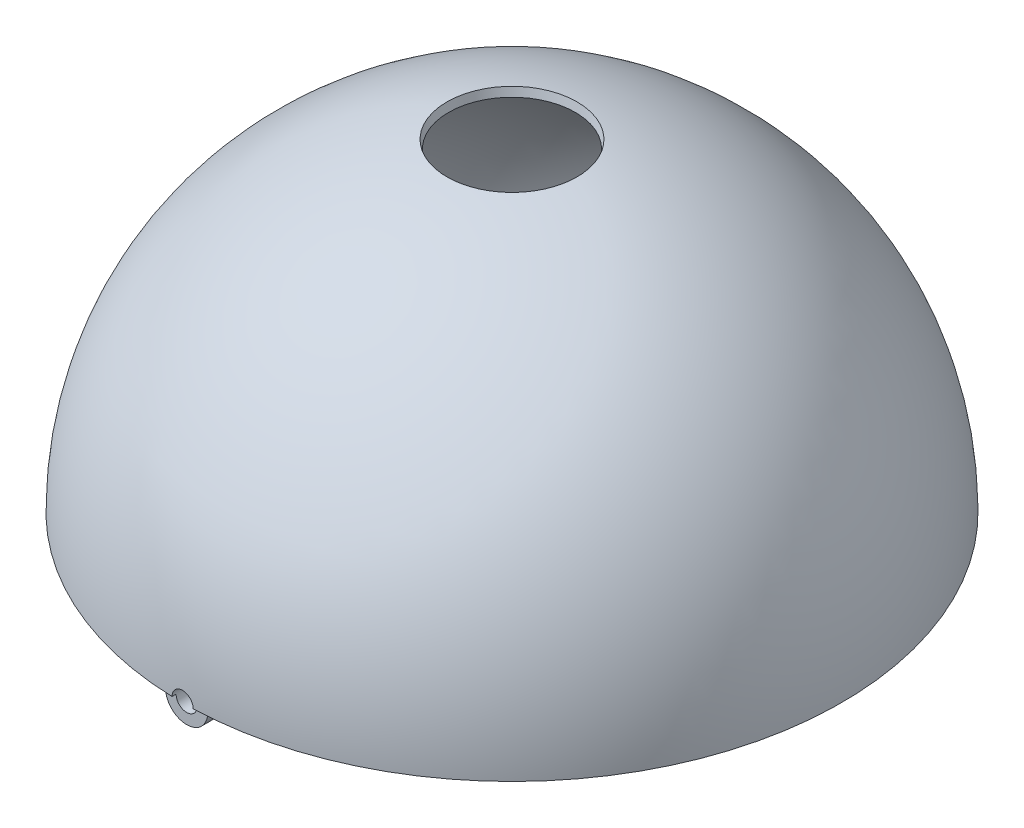
from build123d import *

# Parameters (mm, degrees)
SKETCH2_R           = 5
BOSS_EXTRUDE1_DEPTH = 10
CUT_EXTRUDE1_START  = -5
SKETCH4_R           = 1.4
CUT_EXTRUDE1_DEPTH  = 5
SKETCH5_R           = 2.45
CUT_EXTRUDE2_DEPTH  = 3
SKETCH6_R           = 2.5
CUT_EXTRUDE3_DEPTH  = 13
SKETCH7_R           = 1
CUT_EXTRUDE4_DEPTH  = 13


with BuildPart() as part:
    # Sketch1 → Revolve1 (revolve)
    with BuildSketch(Plane.XY):
        with BuildLine():
            Line((-78, 0), (-76, 0))
            ThreePointArc((-76, 0), (-58.804761712, 48.145612469), (-15, 74.505033387))
            Line((-15, 74.505033387), (-15.394736842, 76.46569216))
            ThreePointArc((-15.394736842, 76.46569216), (-60.352255441, 49.412602271), (-78, 0))
        make_face()
    revolve(axis=Axis((0, 0, 0), (0, 1, 0)))

    # Sketch2 → Boss-Extrude1 (add)
    with BuildSketch(Plane.XY.offset(77)):
        Circle(SKETCH2_R)
    boss_extrude1 = extrude(amount=-BOSS_EXTRUDE1_DEPTH)

    # Sketch3 → Revolve2 (revolve)
    with BuildSketch(Plane.XY):
        with BuildLine():
            Line((-30.7, 59.691121618), (-30.7, 69.691121618))
            ThreePointArc((-30.7, 69.691121618), (-39.521503729, 65.237677957), (-47.7, 59.691121618))
            Line((-47.7, 59.691121618), (-30.7, 59.691121618))
        make_face()
    revolve(axis=Axis((0, 76.46569216, 0), (0, -1, 0)))

    # Sketch4 → Cut-Extrude1 (cut)
    # profile 1 of 3: a face of its own
    with BuildSketch(Plane.XZ.offset(-59.691121618).offset(CUT_EXTRUDE1_START)):
        with Locations((-34.1, 3.2)):
            Circle(SKETCH4_R)
    # profile 2 of 3: a face of its own
    with BuildSketch(Plane.XZ.offset(-59.691121618).offset(CUT_EXTRUDE1_START)):
        with Locations((-34.1, -3.2)):
            Circle(SKETCH4_R)
    # profile 3 of 3: a face of its own
    with BuildSketch(Plane.XZ.offset(-59.691121618).offset(CUT_EXTRUDE1_START)):
        with BuildLine():
            Line((-30.7, 19.275), (-30.7, -19.275))
            ThreePointArc((-30.7, -19.275), (36.249353443, 0), (-30.7, 19.275))
        make_face()
        with BuildLine():
            Line((-23.894860849, 19.275), (-23.894860849, -19.275))
            ThreePointArc((-23.894860849, -19.275), (30.7, 0), (-23.894860849, 19.275))
        make_face(mode=Mode.SUBTRACT)
    extrude(amount=CUT_EXTRUDE1_DEPTH, mode=Mode.SUBTRACT)

    # Mirror1: Boss-Extrude1 across plane
    add(boss_extrude1.mirror(Plane.XY))

    # Sketch5 → Cut-Extrude2 (cut)
    with BuildSketch(Plane(origin=(0, 0, 67), x_dir=(-1, 0, 0), z_dir=(0, 0, -1))):
        Circle(SKETCH5_R)
    extrude(amount=-CUT_EXTRUDE2_DEPTH, mode=Mode.SUBTRACT)

    # Sketch6 → Cut-Extrude3 (cut)
    with BuildSketch(Plane(origin=(0, 0, 72), x_dir=(-1, 0, 0), z_dir=(0, 0, -1))):
        Circle(SKETCH6_R)
    extrude(amount=-CUT_EXTRUDE3_DEPTH, mode=Mode.SUBTRACT)

    # Sketch7 → Cut-Extrude4 (cut)
    with BuildSketch(Plane(origin=(0, 0, 70), x_dir=(-1, 0, 0), z_dir=(0, 0, -1))):
        Circle(SKETCH7_R)
    extrude(amount=-CUT_EXTRUDE4_DEPTH, mode=Mode.SUBTRACT)


solid = part.part
